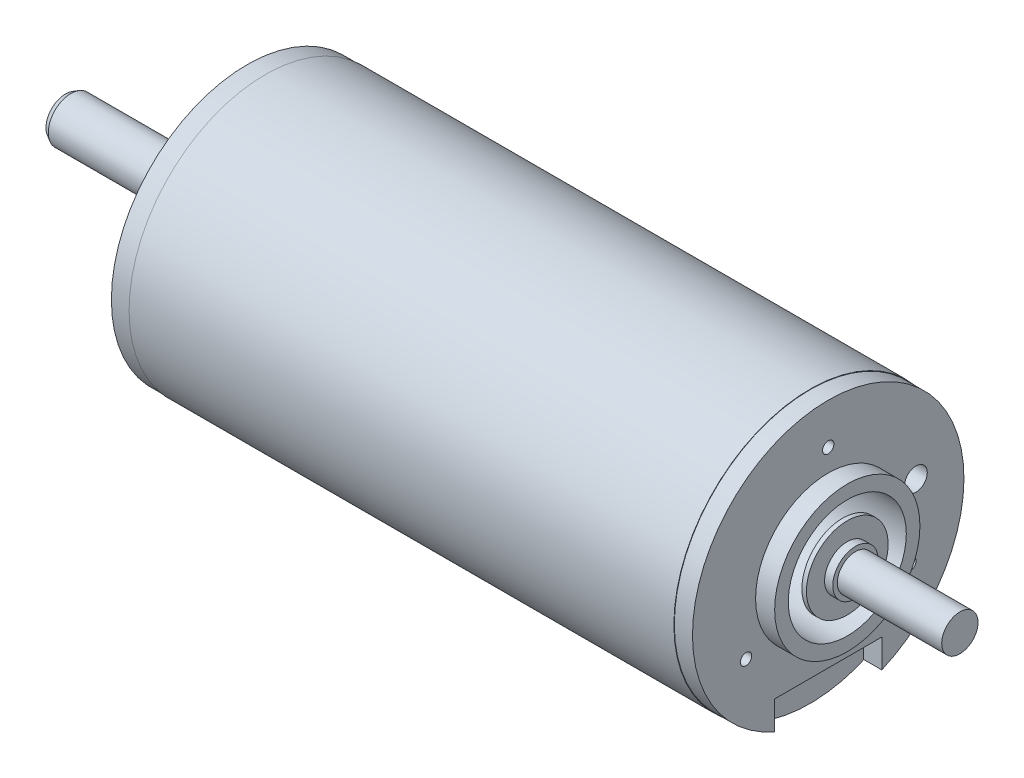
from build123d import *

# Parameters (mm, degrees)
SKETCH1_W           = 60
SKETCH1_H           = 15
BOSS_EXTRUDE1_DEPTH = 2
SKETCH3_R           = 8
BOSS_EXTRUDE2_DEPTH = 2.1
HOLE1_D             = 13
HOLE1_DEPTH         = 0.5
BOSS_EXTRUDE3_START = 2
SKETCH6_R           = 14.95
BOSS_EXTRUDE3_DEPTH = 2
BOSS_EXTRUDE4_START = 1.2
SKETCH7_R           = 8
BOSS_EXTRUDE4_DEPTH = 1.2
HOLE2_D             = 13
HOLE2_DEPTH         = 67.3
SKETCH12_W          = 1.25
SKETCH12_H          = 2
SKETCH14_W          = 1.25
SKETCH14_H          = 2
CHAMFER1_SIZE       = 0.346410161
CHAMFER1_SIZE2      = 0.6


with BuildPart() as part:
    # Sketch1 → Revolve1 (revolve)
    with BuildSketch(Plane(origin=(0, 0, 0), x_dir=(-1, 0, 0), z_dir=(0, 0, -1))):
        with Locations((-32, 7.5)):
            Rectangle(SKETCH1_W, SKETCH1_H)
    revolve(axis=Axis((62, 0, 0), (-1, 0, 0)))

    # Sketch2 → Boss-Extrude1 (add)
    with BuildSketch(Plane(origin=(62, 0, 0), x_dir=(0, 0, -1), z_dir=(1, 0, 0))):
        with BuildLine():
            Line((5.9, -13.736538865), (5.9, -10.6))
            Line((5.9, -10.6), (-5.9, -10.6))
            Line((-5.9, -10.6), (-5.9, -13.736538865))
            ThreePointArc((-5.9, -13.736538865), (0, 14.95), (5.9, -13.736538865))
        make_face()
    extrude(amount=BOSS_EXTRUDE1_DEPTH)

    # Sketch3 → Boss-Extrude2 (add)
    with BuildSketch(Plane(origin=(64, 0, 0), x_dir=(0, 0, -1), z_dir=(1, 0, 0))):
        Circle(SKETCH3_R)
    extrude(amount=BOSS_EXTRUDE2_DEPTH)

    # Hole1
    with Locations(Plane(origin=(66.1, 0, 0), x_dir=(0, 0, -1), z_dir=(1, 0, 0))):
        with Locations((0, 0)):
            Hole(HOLE1_D / 2, depth=HOLE1_DEPTH)

    # Sketch6 → Boss-Extrude3 (add)
    with BuildSketch(Plane.ZY.offset(-2).offset(BOSS_EXTRUDE3_START)):
        Circle(SKETCH6_R)
    extrude(amount=-BOSS_EXTRUDE3_DEPTH)

    # Sketch7 → Boss-Extrude4 (add)
    with BuildSketch(Plane.ZY.offset(BOSS_EXTRUDE4_START)):
        Circle(SKETCH7_R)
    extrude(amount=-BOSS_EXTRUDE4_DEPTH)

    # Hole2
    with Locations(Plane.ZY.offset(1.2)):
        with Locations((0, 0)):
            Hole(HOLE2_D / 2, depth=HOLE2_DEPTH)

    # Sketch12 → Hole3 (revolve, cut)
    with BuildSketch(Plane(origin=(0, -5, 8.660254038), x_dir=(0, 0, 1), z_dir=(0, 1, 0))):
        with Locations((0.625, 1)):
            Rectangle(SKETCH12_W, SKETCH12_H)
    revolve(axis=Axis((110, -5, 8.660254038), (-1, 0, 0)), mode=Mode.SUBTRACT)

    # Sketch14 → Hole4 (revolve, cut)
    with BuildSketch(Plane(origin=(64, 2.588190451, -9.659258263), x_dir=(0, 0, -1), z_dir=(0, 1, 0))):
        with Locations((0.625, 1)):
            Rectangle(SKETCH14_W, SKETCH14_H)
    revolve(axis=Axis((-46, 2.588190451, -9.659258263), (1, 0, 0)), mode=Mode.SUBTRACT)

    # Sketch16 → Hole5 (revolve, cut)
    with BuildSketch(Plane(origin=(0, 0, 11), x_dir=(0, 0, 1), z_dir=(0, 1, 0))):
        Polygon((0, 0), (0, 7.251075774), (1.25, 6.5), (1.25, 0), align=None)
    revolve(axis=Axis((-4.244199587, 0, 11), (1, 0, 0)), mode=Mode.SUBTRACT)

    # Sketch18 → Hole6 (revolve, cut)
    with BuildSketch(Plane.ZX.offset(11)):
        Polygon((0, 0), (0, 7.251075774), (1.25, 6.5), (1.25, 0), align=None)
    revolve(axis=Axis((-4.244199587, 11, 0), (1, 0, 0)), mode=Mode.SUBTRACT)

    # Sketch20 → Hole7 (revolve, cut)
    with BuildSketch(Plane(origin=(0, 0, -11), x_dir=(0, 0, 1), z_dir=(0, 1, 0))):
        Polygon((0, 0), (0, 7.251075774), (1.25, 6.5), (1.25, 0), align=None)
    revolve(axis=Axis((-4.244199587, 0, -11), (1, 0, 0)), mode=Mode.SUBTRACT)

    # Sketch22 → Hole8 (revolve, cut)
    with BuildSketch(Plane.ZX.offset(-11)):
        Polygon((0, 0), (0, 7.251075774), (1.25, 6.5), (1.25, 0), align=None)
    revolve(axis=Axis((-4.244199587, -11, 0), (1, 0, 0)), mode=Mode.SUBTRACT)

    # Sketch24 → Hole9 (revolve, cut)
    with BuildSketch(Plane(origin=(64, 10.45, 0), x_dir=(0, 0, -1), z_dir=(0, 1, 0))):
        Polygon((0, 0), (0, 3.175537887), (0.625, 2.8), (0.625, 0), align=None)
    revolve(axis=Axis((68.244199587, 10.45, 0), (-1, 0, 0)), mode=Mode.SUBTRACT)

    # Sketch26 → Hole10 (revolve, cut)
    with BuildSketch(Plane(origin=(64, -5.225, -9.04996547), x_dir=(0, 0, -1), z_dir=(0, 1, 0))):
        Polygon((0, 0), (0, 3.175537887), (0.625, 2.8), (0.625, 0), align=None)
    revolve(axis=Axis((68.244199587, -5.225, -9.04996547), (-1, 0, 0)), mode=Mode.SUBTRACT)

    # Sketch28 → Hole11 (revolve, cut)
    with BuildSketch(Plane(origin=(64, -5.225, 9.04996547), x_dir=(0, 0, -1), z_dir=(0, 1, 0))):
        Polygon((0, 0), (0, 3.175537887), (0.625, 2.8), (0.625, 0), align=None)
    revolve(axis=Axis((68.244199587, -5.225, 9.04996547), (-1, 0, 0)), mode=Mode.SUBTRACT)


with BuildPart() as body_2:
    # Sketch10 → Revolve2 (revolve)
    with BuildSketch(Plane(origin=(0, 0, 0), x_dir=(-1, 0, 0), z_dir=(0, 0, -1))):
        Polygon((0.7, 4.5), (0.7, 0), (20, 0), (20, 2.5), (1.2, 2.5), (1.2, 4.5), align=None)
    revolve(axis=Axis((-0.7, 0, 0), (-1, 0, 0)))

    # Chamfer1
    chamfer1_edges = [body_2.edges().sort_by_distance(p)[0] for p in [
        (-20, -2.5, 0),
    ]]
    chamfer1_side = [body_2.faces().sort_by_distance(p)[0] for p in [
        (-20, 0, 0),
    ]]
    chamfer(chamfer1_edges, length=CHAMFER1_SIZE, length2=CHAMFER1_SIZE2, reference=chamfer1_side[0])


with BuildPart() as body_3:
    # Sketch11 → Revolve3 (revolve)
    with BuildSketch(Plane(origin=(0, 0, 0), x_dir=(-1, 0, 0), z_dir=(0, 0, -1))):
        Polygon((-78.5, 2), (-78.5, 0), (-65.6, 0), (-65.6, 4.5), (-66.1, 4.5), (-66.1, 2.5), (-67, 2.5), (-67, 2), align=None)
    revolve(axis=Axis((78.5, 0, 0), (-1, 0, 0)))


solid = Compound([part.part, body_2.part, body_3.part])
